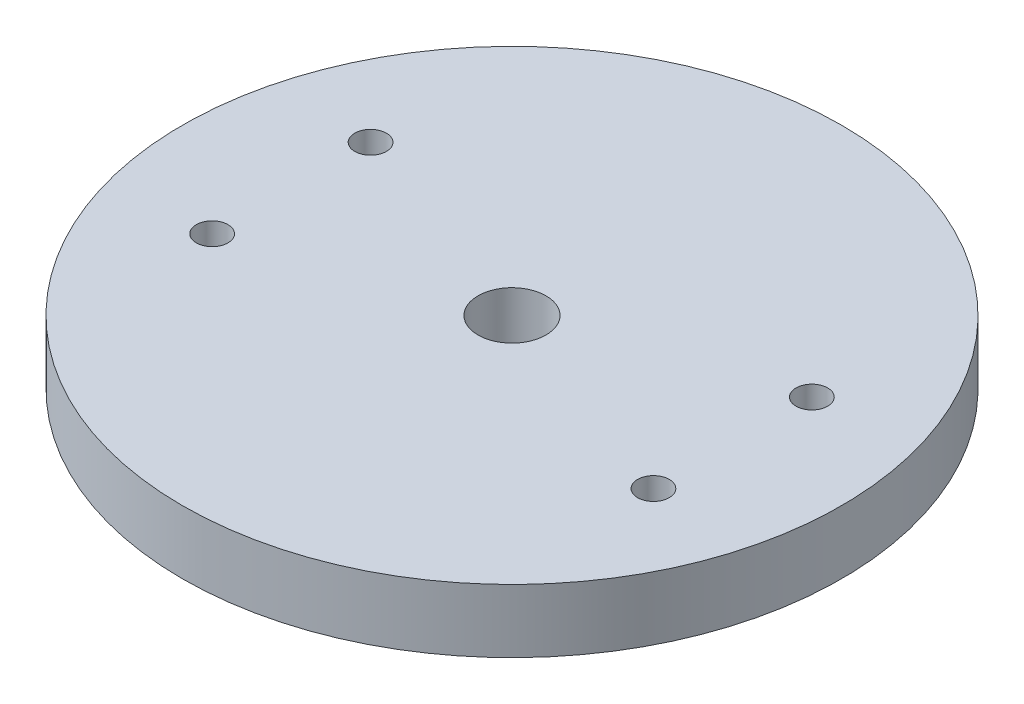
from build123d import *

# Parameters (mm, degrees)
SKETCH1_R               = 66.04
BOSS_EXTRUDE1_DEPTH     = 12.7
CUT_EXTRUDE1_DEPTH      = 95.254194602
CUT_EXTRUDE1_DEPTH_BACK = 95.254194602
SKETCH2_R               = 3.175
SKETCH4_R               = 6.81066759
CUT_EXTRUDE2_DEPTH      = 95.254194602


with BuildPart() as part:
    # Sketch1 → Boss-Extrude1 (new body)
    with BuildSketch(Plane(origin=(0, 0, 0), x_dir=(1, 0, 0), z_dir=(0, 1, 0))):
        Circle(SKETCH1_R)
    extrude(amount=BOSS_EXTRUDE1_DEPTH)

    # Sketch2 → Cut-Extrude1 (cut, two sides: drawn at the far end of the back side and taken through both)
    with BuildSketch(Plane(origin=(0, 12.7, 0), x_dir=(1, 0, 0), z_dir=(0, 1, 0)).offset(-CUT_EXTRUDE1_DEPTH_BACK)):
        with Locations((-44.214813621, 15.875)):
            Circle(SKETCH2_R)
        with Locations((-44.214813621, -15.875)):
            Circle(SKETCH2_R)
        with Locations((44.214813621, -15.875)):
            Circle(SKETCH2_R)
        with Locations((44.214813621, 15.875)):
            Circle(SKETCH2_R)
    extrude(amount=CUT_EXTRUDE1_DEPTH + CUT_EXTRUDE1_DEPTH_BACK, mode=Mode.SUBTRACT)

    # Sketch4 → Cut-Extrude2 (cut, through all)
    with BuildSketch(Plane.XZ):
        Circle(SKETCH4_R)
    extrude(amount=-CUT_EXTRUDE2_DEPTH, mode=Mode.SUBTRACT)


solid = part.part
